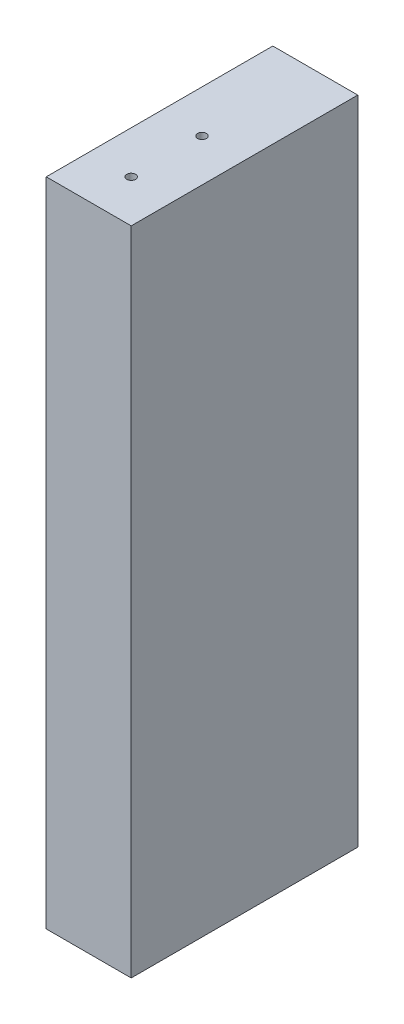
from build123d import *

# Parameters (mm, degrees)
SKETCH1_W                           = 19.05
SKETCH1_H                           = 146.05
BOSS_EXTRUDE1_DEPTH                 = 50.8
F_5_64_0_07813_DIAMETER_HOLE1_D     = 1.984502
F_5_64_0_07813_DIAMETER_HOLE1_DEPTH = 38.1
F_5_64_0_07813_DIAMETER_HOLE1_TIP   = 0.59620455
F_5_64_0_07813_DIAMETER_HOLE2_D     = 1.984502
F_5_64_0_07813_DIAMETER_HOLE2_DEPTH = 38.1
F_5_64_0_07813_DIAMETER_HOLE2_TIP   = 0.59620455
F_5_64_0_07813_DIAMETER_HOLE3_D     = 1.984502
F_5_64_0_07813_DIAMETER_HOLE3_DEPTH = 19.05
F_5_64_0_07813_DIAMETER_HOLE3_TIP   = 0.59620455
F_5_64_0_07813_DIAMETER_HOLE4_D     = 1.984502
F_5_64_0_07813_DIAMETER_HOLE4_DEPTH = 19.05
F_5_64_0_07813_DIAMETER_HOLE4_TIP   = 0.59620455


with BuildPart() as part:
    # Sketch1 → Boss-Extrude1 (new body)
    with BuildSketch(Plane.XY):
        with Locations((472.231312422, 6358.255)):
            Rectangle(SKETCH1_W, SKETCH1_H)
    extrude(amount=BOSS_EXTRUDE1_DEPTH)

    # 5/64 (0.07813) Diameter Hole1
    with Locations(Plane(origin=(0, 1.6e-08, -19.050112211), x_dir=(-1, 0, 0), z_dir=(0, 8.559955098618183e-10, -1.0))):
        with Locations((-481.589248274, 6993.254992531), (-386.339248274, 6993.254992531), (-291.089248274, 6993.254992531), (-295.274999999, 6965.135938475), (-295.274999999, 6812.735938475), (-295.274999999, 6660.335938474), (-285.166362357, 6631.468843414), (-475.477307398, 6631.468752771), (-485.002307398, 6660.335938474), (-485.002307398, 6812.735938474), (-485.002307398, 6965.135938474), (-478.365617646, 6611.6708), (-287.865617646, 6611.6708), (-307.975, 6564.3379), (-307.975, 6488.1379), (-284.960913066, 6440.805), (-380.210913066, 6440.805), (-475.460913066, 6440.805), (-446.831312422, 6488.1379), (-446.831312422, 6564.3379), (-472.231312422, 6396.355), (-472.231312422, 6320.155), (-472.653156211, 6275.705000839), (-377.403156211, 6275.705000839), (-282.153156211, 6275.705000839), (-282.575, 6320.155), (-282.575, 6396.355), (-435.598646187, 6221.729999816), (-435.598646187, 6145.529999816), (-450.592518112, 6091.554999951), (-460.998646187, 6091.555478285), (-460.998646187, 6056.629999944), (-460.998646187, 5980.429999944), (-460.998646187, 5945.505000042), (-282.153156211, 5945.505000042), (-368.611823093, 5945.505000042)):
            Hole(F_5_64_0_07813_DIAMETER_HOLE1_D / 2, depth=F_5_64_0_07813_DIAMETER_HOLE1_DEPTH)
            with Locations((0, 0, -(F_5_64_0_07813_DIAMETER_HOLE1_DEPTH + F_5_64_0_07813_DIAMETER_HOLE1_TIP / 2))):  # 118° drill point
                Cone(0, F_5_64_0_07813_DIAMETER_HOLE1_D / 2, F_5_64_0_07813_DIAMETER_HOLE1_TIP, mode=Mode.SUBTRACT)

    # 5/64 (0.07813) Diameter Hole2
    with Locations(Plane(origin=(189.656312422, 1.6e-08, -19.050112211), x_dir=(-1, 0, 0), z_dir=(0, 8.559955098618183e-10, -1.0))):
        with Locations((-481.589248274, 6993.254992531), (-386.339248274, 6993.254992531), (-291.089248274, 6993.254992531), (-295.274999999, 6965.135938475), (-295.274999999, 6812.735938475), (-295.274999999, 6660.335938474), (-285.166362357, 6631.468843414), (-475.477307398, 6631.468752771), (-485.002307398, 6660.335938474), (-485.002307398, 6812.735938474), (-485.002307398, 6965.135938474), (-478.365617646, 6611.6708), (-287.865617646, 6611.6708), (-307.975, 6564.3379), (-307.975, 6488.1379), (-284.960913066, 6440.805), (-380.210913066, 6440.805), (-475.460913066, 6440.805), (-446.831312422, 6488.1379), (-446.831312422, 6564.3379), (-472.231312422, 6396.355), (-472.231312422, 6320.155), (-472.653156211, 6275.705000839), (-377.403156211, 6275.705000839), (-282.153156211, 6275.705000839), (-282.575, 6320.155), (-282.575, 6396.355), (-435.598646187, 6221.729999816), (-435.598646187, 6145.529999816), (-450.592518112, 6091.554999951), (-460.998646187, 6091.555478285), (-460.998646187, 6056.629999944), (-460.998646187, 5980.429999944), (-460.998646187, 5945.505000042), (-282.153156211, 5945.505000042), (-368.611823093, 5945.505000042)):
            Hole(F_5_64_0_07813_DIAMETER_HOLE2_D / 2, depth=F_5_64_0_07813_DIAMETER_HOLE2_DEPTH)
            with Locations((0, 0, -(F_5_64_0_07813_DIAMETER_HOLE2_DEPTH + F_5_64_0_07813_DIAMETER_HOLE2_TIP / 2))):  # 118° drill point
                Cone(0, F_5_64_0_07813_DIAMETER_HOLE2_D / 2, F_5_64_0_07813_DIAMETER_HOLE2_TIP, mode=Mode.SUBTRACT)

    # 5/64 (0.07813) Diameter Hole3
    with Locations(Plane(origin=(0, 6431.28, 0), x_dir=(1, 0, 0), z_dir=(0, 1, 0))):
        with Locations((472.231312422, -41.275), (472.231312422, -25.4)):
            Hole(F_5_64_0_07813_DIAMETER_HOLE3_D / 2, depth=F_5_64_0_07813_DIAMETER_HOLE3_DEPTH)
            with Locations((0, 0, -(F_5_64_0_07813_DIAMETER_HOLE3_DEPTH + F_5_64_0_07813_DIAMETER_HOLE3_TIP / 2))):  # 118° drill point
                Cone(0, F_5_64_0_07813_DIAMETER_HOLE3_D / 2, F_5_64_0_07813_DIAMETER_HOLE3_TIP, mode=Mode.SUBTRACT)

    # 5/64 (0.07813) Diameter Hole4
    with Locations(Plane(origin=(0, 6285.23, 0), x_dir=(-1, 0, 0), z_dir=(0, -1, 0))):
        with Locations((-472.231312422, -25.4), (-472.231312422, -41.275)):
            Hole(F_5_64_0_07813_DIAMETER_HOLE4_D / 2, depth=F_5_64_0_07813_DIAMETER_HOLE4_DEPTH)
            with Locations((0, 0, -(F_5_64_0_07813_DIAMETER_HOLE4_DEPTH + F_5_64_0_07813_DIAMETER_HOLE4_TIP / 2))):  # 118° drill point
                Cone(0, F_5_64_0_07813_DIAMETER_HOLE4_D / 2, F_5_64_0_07813_DIAMETER_HOLE4_TIP, mode=Mode.SUBTRACT)


solid = part.part
